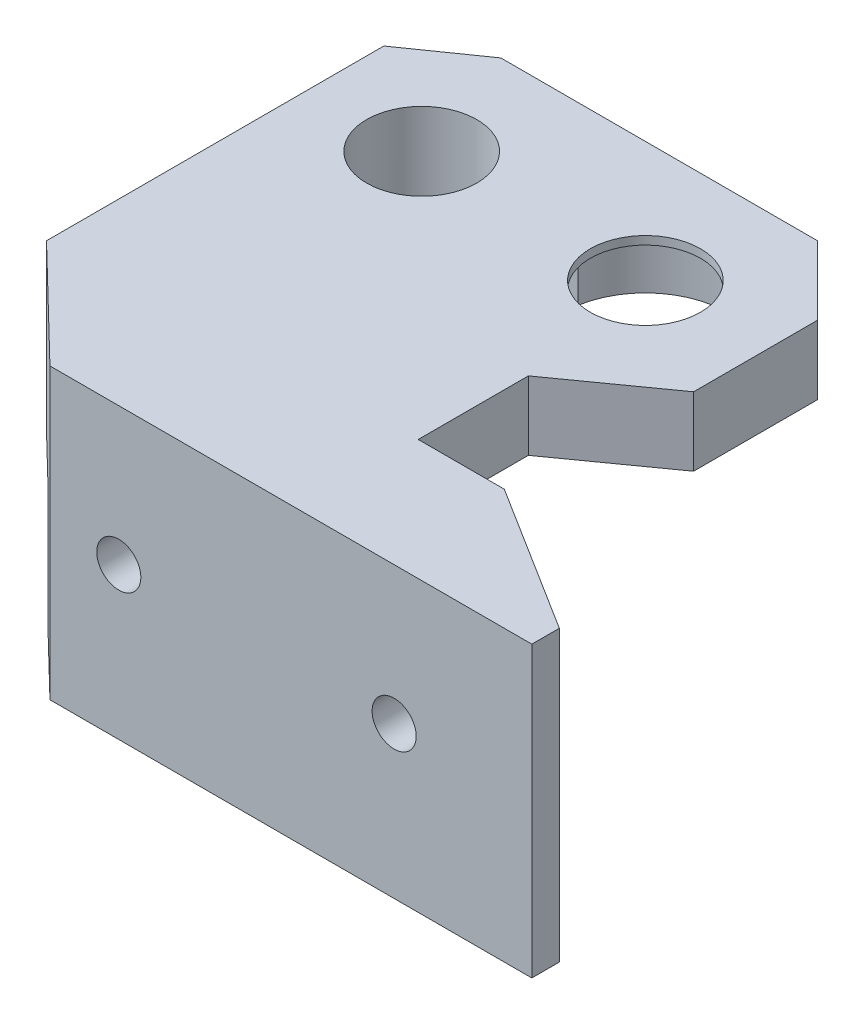
from build123d import *

# Parameters (mm, degrees)
SKETCH1_R           = 4
BOSS_EXTRUDE1_DEPTH = 5
BOSS_EXTRUDE2_DEPTH = 7
BOSS_EXTRUDE3_DEPTH = 16
BOSS_EXTRUDE4_START = 2.5
SKETCH6_R           = 7
SKETCH6_R_2         = 4
BOSS_EXTRUDE4_DEPTH = 2.5
CUT_EXTRUDE1_DEPTH  = 4.4
CUT_EXTRUDE2_DEPTH  = 42.631988903
SKETCH8_R           = 1.6
CUT_EXTRUDE3_DEPTH  = 47.066527979
SKETCH9_R           = 3
CUT_EXTRUDE4_DEPTH  = 4
SKETCH10_W          = 49.222079373
SKETCH10_H          = 35.75
CUT_EXTRUDE5_DEPTH  = 71.590810308


with BuildPart() as part:
    # Sketch1 → Boss-Extrude1 (new body)
    with BuildSketch(Plane(origin=(0, 0, 0), x_dir=(1, 0, 0), z_dir=(0, 1, 0))):
        Polygon((-3.75, 8.75), (19.25, 8.75), (24.25, 5.25), (24.25, -19.25), (16.25, -27), (-18.75, -27), (-18.75, -25), (-8, -18.25), (-1.75, -18.25), (-1.75, -10.25), (-8.75, -5.25), (-8.75, 3.75), align=None)
        Circle(SKETCH1_R, mode=Mode.SUBTRACT)
        with Locations((16.25, 0)):
            Circle(SKETCH1_R, mode=Mode.SUBTRACT)
    boss_extrude1 = extrude(amount=BOSS_EXTRUDE1_DEPTH)

    # Sketch2 → Boss-Extrude2 (add)
    with BuildSketch(Plane.XZ):
        Polygon((24.25, 19.25), (24.25, -5.25), (20.75, -5.25), (20.75, 18.25), (-8, 18.25), (-14.37037037, 22.25), (21.153225806, 22.25), align=None)
    boss_extrude2 = extrude(amount=BOSS_EXTRUDE2_DEPTH)

    # Sketch3 → Boss-Extrude3 (add)
    with BuildSketch(Plane.XZ):
        Polygon((-14.37037037, 22.25), (21.153225806, 22.25), (16.25, 27), (-18.75, 27), (-18.75, 25), align=None)
    boss_extrude3 = extrude(amount=BOSS_EXTRUDE3_DEPTH)

    # Sketch6 → Boss-Extrude4 (add)
    with BuildSketch(Plane.XZ.offset(BOSS_EXTRUDE4_START)):
        with Locations((16.25, 0)):
            Circle(SKETCH6_R)
        with Locations((16.25, 0)):
            Circle(SKETCH6_R_2, mode=Mode.SUBTRACT)
    boss_extrude4 = extrude(amount=-BOSS_EXTRUDE4_DEPTH)

    # Sketch4 → Cut-Extrude1 (cut)
    with BuildSketch(Plane.XZ):
        with BuildLine():
            Line((5.883782294, -1), (12.377016654, -1))
            ThreePointArc((12.377016654, -1), (12.25, 0), (12.377016654, 1))
            Line((12.377016654, 1), (5.883782294, 1))
            ThreePointArc((5.883782294, 1), (-5.968156673, 0), (5.883782294, -1))
        make_face()
    cut_extrude1 = extrude(amount=-CUT_EXTRUDE1_DEPTH, mode=Mode.SUBTRACT)

    # Sketch7 → Cut-Extrude2 (cut, through all)
    with BuildSketch(Plane.XZ.offset(-4.4)):
        with BuildLine():
            Line((5.883782294, -1), (12.377016654, -1))
            ThreePointArc((12.377016654, -1), (12.25, 0), (12.377016654, 1))
            Line((12.377016654, 1), (5.883782294, 1))
            ThreePointArc((5.883782294, 1), (-5.968156673, 0), (5.883782294, -1))
        make_face()
    cut_extrude2 = extrude(amount=CUT_EXTRUDE2_DEPTH, mode=Mode.SUBTRACT)

    # Sketch8 → Cut-Extrude3 (cut, through all)
    with BuildSketch(Plane.XY.offset(27)):
        with Locations((11.25, -5)):
            Circle(SKETCH8_R)
        with Locations((-8.75, -5)):
            Circle(SKETCH8_R)
    cut_extrude3 = extrude(amount=-CUT_EXTRUDE3_DEPTH, mode=Mode.SUBTRACT)

    # Sketch9 → Cut-Extrude4 (cut)
    with BuildSketch(Plane(origin=(0, 0, 18.25), x_dir=(-1, 0, 0), z_dir=(0, 0, -1))):
        with Locations((-11.25, -5)):
            Circle(SKETCH9_R)
        with Locations((8.75, -5)):
            Circle(SKETCH9_R)
    cut_extrude4 = extrude(amount=-CUT_EXTRUDE4_DEPTH, mode=Mode.SUBTRACT)

    # Mirror1: Boss-Extrude1, Boss-Extrude2, Boss-Extrude3, Boss-Extrude4, Cut-Extrude1, Cut-Extrude2, Cut-Extrude3, Cut-Extrude4 across plane
    add(boss_extrude1.mirror(Plane(origin=(-18.75, 5, 27), x_dir=(0, 0, 1), z_dir=(1, 0, 0))))
    add(boss_extrude2.mirror(Plane(origin=(-18.75, 5, 27), x_dir=(0, 0, 1), z_dir=(1, 0, 0))))
    add(boss_extrude3.mirror(Plane(origin=(-18.75, 5, 27), x_dir=(0, 0, 1), z_dir=(1, 0, 0))))
    add(boss_extrude4.mirror(Plane(origin=(-18.75, 5, 27), x_dir=(0, 0, 1), z_dir=(1, 0, 0))))
    add(cut_extrude1.mirror(Plane(origin=(-18.75, 5, 27), x_dir=(0, 0, 1), z_dir=(1, 0, 0))), mode=Mode.SUBTRACT)
    add(cut_extrude2.mirror(Plane(origin=(-18.75, 5, 27), x_dir=(0, 0, 1), z_dir=(1, 0, 0))), mode=Mode.SUBTRACT)
    add(cut_extrude3.mirror(Plane(origin=(-18.75, 5, 27), x_dir=(0, 0, 1), z_dir=(1, 0, 0))), mode=Mode.SUBTRACT)
    add(cut_extrude4.mirror(Plane(origin=(-18.75, 5, 27), x_dir=(0, 0, 1), z_dir=(1, 0, 0))), mode=Mode.SUBTRACT)

    # Sketch10 → Cut-Extrude5 (cut, through all)
    with BuildSketch(Plane(origin=(0, 5, 0), x_dir=(1, 0, 0), z_dir=(0, 1, 0))):
        with Locations((5.861039687, -9.125)):
            Rectangle(SKETCH10_W, SKETCH10_H)
    extrude(amount=-CUT_EXTRUDE5_DEPTH, mode=Mode.SUBTRACT)


solid = part.part
